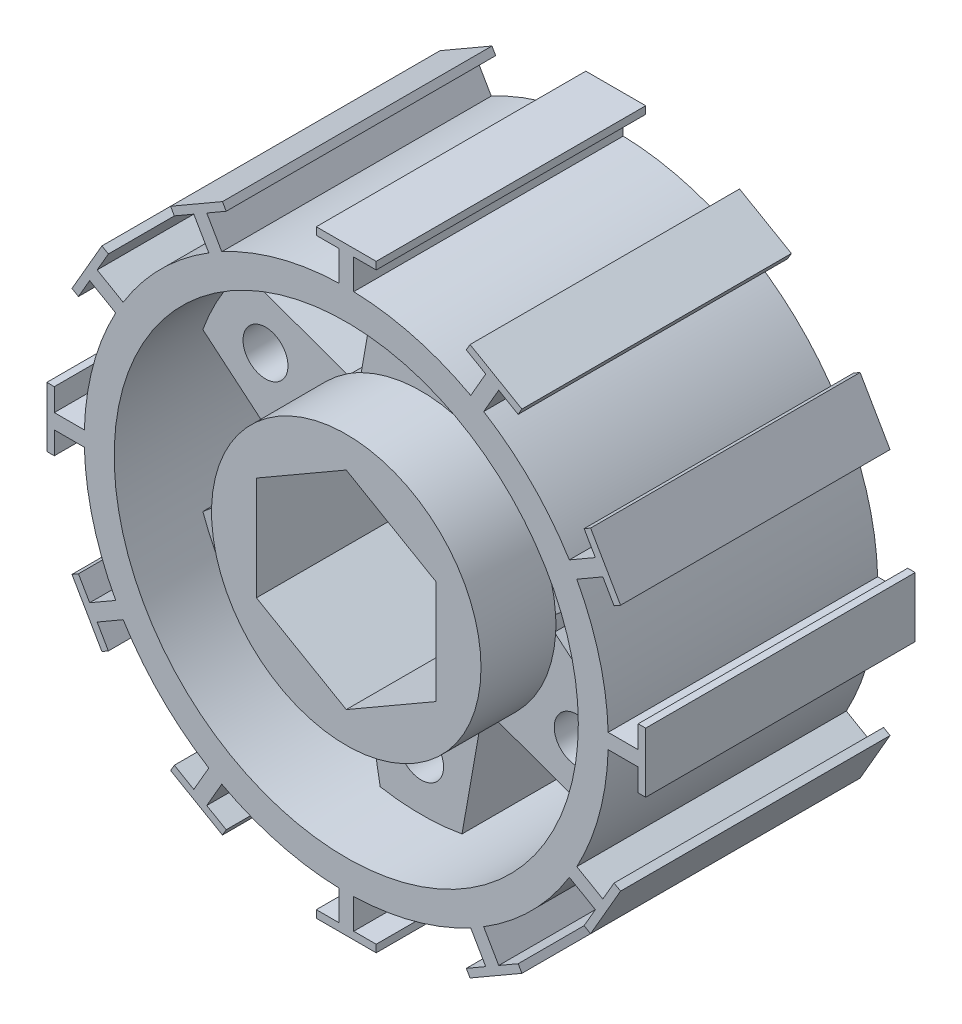
from build123d import *
from build123d.topology import SkipClean

# Parameters (mm, degrees)
SKETCH_1_R               = 27
EXTRUDE_1_DEPTH          = 10
FILLET_1_R               = 2
SKETCH_2_R               = 15.5
CUT_EXTRUDE_2_DEPTH      = 6
SKETCH_4_R               = 9
EXTRUDE_2_DEPTH          = 5
CUT_EXTRUDE_3_DEPTH      = 10
SKETCH_6_R               = 1.5
CUT_EXTRUDE_4_DEPTH      = 40.736633041
CUT_EXTRUDE_START        = -4
SKETCH_8_R               = 15.5
CUT_EXTRUDE_5_DEPTH      = 4
CUT_EXTRUDE_8_DEPTH      = 41.669398882
SKETCH_10_R              = 1.5
CUT_EXTRUDE_9_DEPTH      = 41.669398882
PATTERN_CIRCULAR_2_COUNT = 6
SKETCH_11_R              = 5
CUT_EXTRUDE_10_DEPTH     = 2
FILLET_2_R               = 1
SKETCH_12_OUTSIDE_W      = 71.788
SKETCH_12_OUTSIDE_H      = 71.788
SKETCH_12_OUTSIDE_R      = 17.5
CUT_EXTRUDE_11_DEPTH     = 20
EXTRUDE_3_DEPTH          = 10
PATTERN_CIRCULAR_3_COUNT = 12
SKETCH_15_R              = 32.027558883
CUT_EXTRUDE_12_DEPTH     = 1
SKETCH_16_R              = 25.808515359
CUT_EXTRUDE_13_DEPTH     = 1


with BuildPart() as part:
    # 草图1 → 凸台-拉伸1 (new, symmetric)
    with BuildSketch(Plane.XY):
        Circle(SKETCH_1_R)
    extrude(amount=EXTRUDE_1_DEPTH, both=True)

    # 圆角1
    fillet_1_edges = [part.edges().sort_by_distance(p)[0] for p in [
        (-27, 0, -10),
        (-27, 0, 10),
    ]]
    fillet(fillet_1_edges, radius=FILLET_1_R)

    # 草图2 → 切除-拉伸2 (cut)
    with BuildSketch(Plane.XY.offset(10)):
        Circle(SKETCH_2_R)
    extrude(amount=-CUT_EXTRUDE_2_DEPTH, mode=Mode.SUBTRACT)

    # 草图4 → 凸台-拉伸2 (add)
    with BuildSketch(Plane.XY.offset(4)):
        Circle(SKETCH_4_R)
    extrude(amount=EXTRUDE_2_DEPTH)

    # 草图5 → 切除-拉伸3 (cut)
    with BuildSketch(Plane.XY.offset(9)):
        Polygon((0, 6.92820323), (-6, 3.464101615), (-6, -3.464101615), (0, -6.92820323), (6, -3.464101615), (6, 3.464101615), align=None)
    extrude(amount=-CUT_EXTRUDE_3_DEPTH, mode=Mode.SUBTRACT)

    # 草图6 → 切除-拉伸4 (cut, through all)
    with BuildSketch(Plane.XY.offset(-1)):
        Circle(SKETCH_6_R)
    extrude(amount=-CUT_EXTRUDE_4_DEPTH, mode=Mode.SUBTRACT)

    # 草图8 → 切除-拉伸5 (cut)
    with BuildSketch(Plane(origin=(0, 0, -10), x_dir=(-1, 0, 0), z_dir=(0, 0, -1)).offset(CUT_EXTRUDE_START)):
        with Locations(Location((0, 0, 0), (0, 0, 180))):
            Circle(SKETCH_8_R)
    extrude(amount=CUT_EXTRUDE_5_DEPTH, mode=Mode.SUBTRACT)

    # 草图9 → 切除-拉伸8 (cut, through all)
    with SkipClean():  # the faces are left unmerged after this step: merging them gives an invalid solid
        with BuildSketch(Plane.XY.offset(4)):
            with BuildLine():
                Line((-8.904732448, 0.5), (-14.57957217, 5.261755918))
                ThreePointArc((-14.57957217, 5.261755918), (-15.5, 0), (-14.57957217, -5.261755918))
                Line((-14.57957217, -5.261755918), (-8.904732448, -0.5))
                ThreePointArc((-8.904732448, -0.5), (-8.91875888, 0), (-8.904732448, 0.5))
            make_face()
        cut_extrude_8 = extrude(amount=-CUT_EXTRUDE_8_DEPTH, mode=Mode.SUBTRACT)
    add(part.part.scale(1), mode=Mode.REPLACE)  # the faces are merged on a copy

    # 草图10 → 切除-拉伸9 (cut, through all)
    with BuildSketch(Plane.XY.offset(4)):
        with Locations((0, 12)):
            Circle(SKETCH_10_R)
    cut_extrude_9 = extrude(amount=-CUT_EXTRUDE_9_DEPTH, mode=Mode.SUBTRACT)

    # 阵列(圆周)2: 切除-拉伸8, 切除-拉伸9 ×6 about axis
    with SkipClean():  # the faces are left unmerged after this step: merging them gives an invalid solid
        pattern_circular_2_axis = Axis((0, 0, 0), (0, 0, 1))
        add([cut_extrude_8.rotate(pattern_circular_2_axis, i * 360 / PATTERN_CIRCULAR_2_COUNT) for i in range(1, PATTERN_CIRCULAR_2_COUNT)], mode=Mode.SUBTRACT)
        add([cut_extrude_9.rotate(pattern_circular_2_axis, i * 360 / PATTERN_CIRCULAR_2_COUNT) for i in range(1, PATTERN_CIRCULAR_2_COUNT)], mode=Mode.SUBTRACT)

    # 草图11 → 切除-拉伸10 (cut)
    with SkipClean():  # the faces are left unmerged after this step: merging them gives an invalid solid
        with BuildSketch(Plane(origin=(0, 0, -6), x_dir=(-1, 0, 0), z_dir=(0, 0, -1))):
            Circle(SKETCH_11_R)
        extrude(amount=-CUT_EXTRUDE_10_DEPTH, mode=Mode.SUBTRACT)

    # 圆角2
    fillet_2_edges = [part.edges().sort_by_distance(p)[0] for p in [
        (5, 0, -6),
    ]]
    fillet(fillet_2_edges, radius=FILLET_2_R)

    # 草图12 outside → 切除-拉伸11 (cut)
    with BuildSketch(Plane.XY.offset(10)):
        Rectangle(SKETCH_12_OUTSIDE_W, SKETCH_12_OUTSIDE_H)
        Circle(SKETCH_12_OUTSIDE_R, mode=Mode.SUBTRACT)
    extrude(amount=-CUT_EXTRUDE_11_DEPTH, mode=Mode.SUBTRACT)

    # 草图13 → 凸台-拉伸3 (add, symmetric)
    with BuildSketch(Plane.XY):
        with BuildLine():
            Line((0.5, 17.492855685), (0.5, 19.5))
            Line((0.5, 19.5), (2, 19.5))
            Line((2, 19.5), (2, 20))
            Line((2, 20), (-2, 20))
            Line((-2, 20), (-2, 19.5))
            Line((-2, 19.5), (-0.5, 19.5))
            Line((-0.5, 19.5), (-0.5, 17.492855685))
            ThreePointArc((-0.5, 17.492855685), (0, 17.5), (0.5, 17.492855685))
        make_face()
    extrude_3 = extrude(amount=EXTRUDE_3_DEPTH, both=True)

    # 阵列(圆周)3: 凸台-拉伸3 ×12 about axis
    with SkipClean():  # the faces are left unmerged after this step: merging them gives an invalid solid
        pattern_circular_3_axis = Axis((0, 0, 0), (0, 0, 1))
        for i in range(1, PATTERN_CIRCULAR_3_COUNT):
            add(extrude_3.rotate(pattern_circular_3_axis, i * 360 / PATTERN_CIRCULAR_3_COUNT))

    # 草图15 → 切除-拉伸12 (cut)
    with SkipClean():  # the faces are left unmerged after this step: merging them gives an invalid solid
        with BuildSketch(Plane(origin=(0, 0, -10), x_dir=(-1, 0, 0), z_dir=(0, 0, -1))):
            Circle(SKETCH_15_R)
        extrude(amount=-CUT_EXTRUDE_12_DEPTH, mode=Mode.SUBTRACT)

    # 草图16 → 切除-拉伸13 (cut)
    with BuildSketch(Plane.XY.offset(10)):
        Circle(SKETCH_16_R)
    extrude(amount=-CUT_EXTRUDE_13_DEPTH, mode=Mode.SUBTRACT)


solid = part.part
